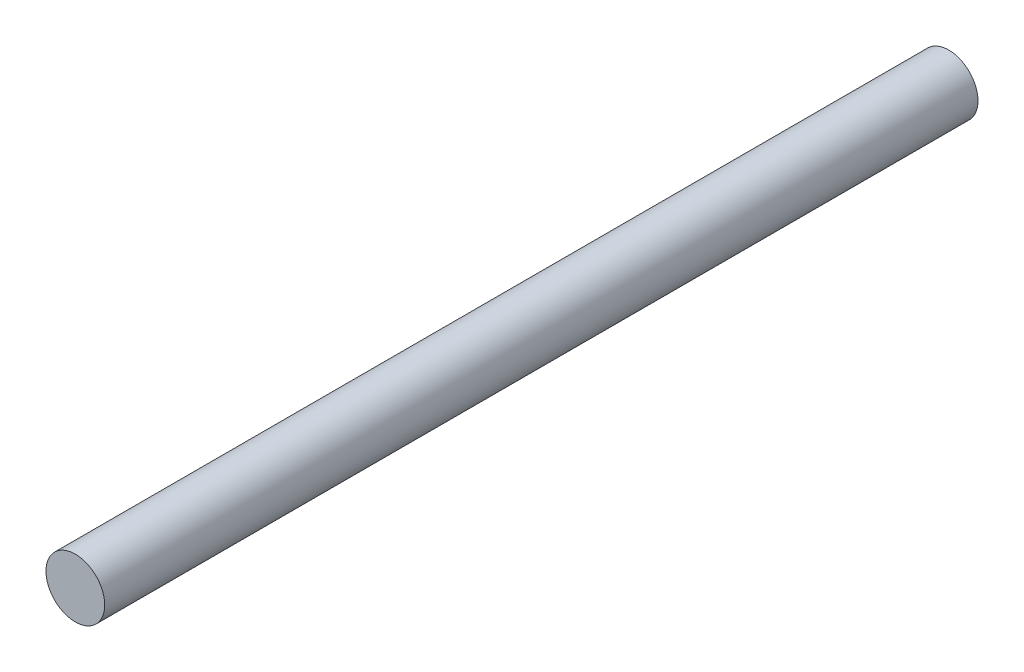
from build123d import *

# Parameters (mm, degrees)
BOSS_EXTRUDE1_DEPTH      = 10
BOSS_EXTRUDE1_DEPTH_BACK = 64
SKETCH1_R                = 2.49


with BuildPart() as part:
    # Sketch1 → Boss-Extrude1 (new, two sides: drawn at the far end of the back side and taken through both)
    with BuildSketch(Plane.XY.offset(-BOSS_EXTRUDE1_DEPTH_BACK)):
        Circle(SKETCH1_R)
    extrude(amount=BOSS_EXTRUDE1_DEPTH + BOSS_EXTRUDE1_DEPTH_BACK)


solid = part.part
